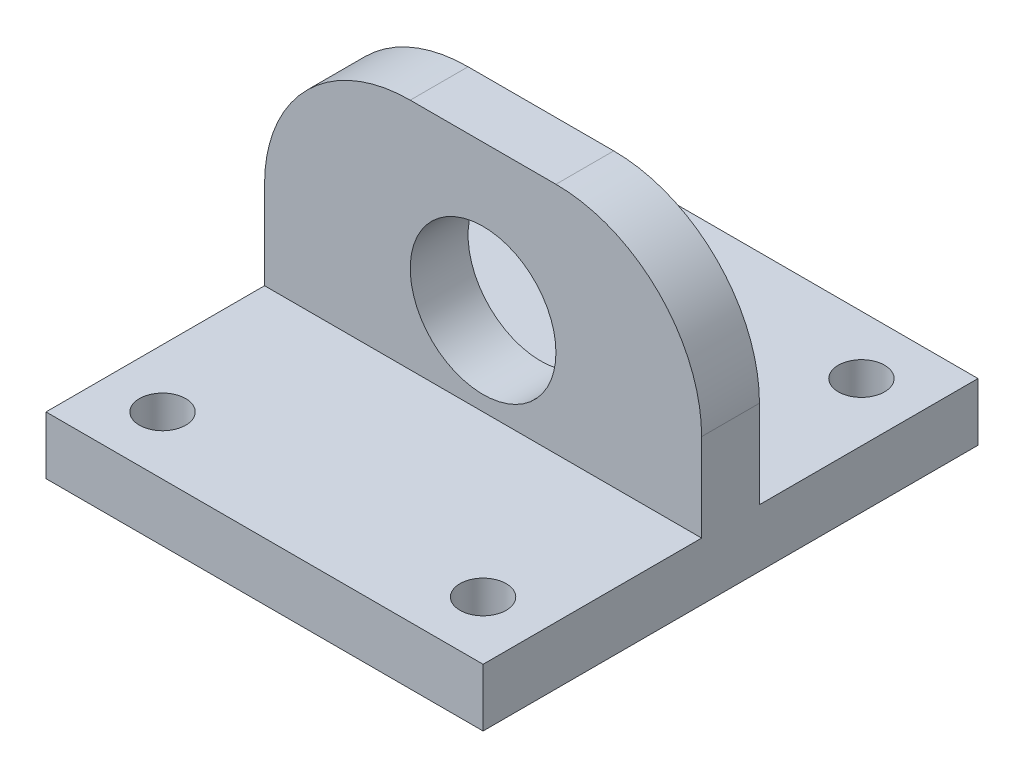
from build123d import *

# Parameters (mm, degrees)
CROQUIS1_R              = 10
SALIENTE_EXTRUIR1_DEPTH = 3.96875
CROQUIS3_W              = 30
CROQUIS3_H              = 7.9375
SALIENTE_EXTRUIR2_DEPTH = 30
CROQUIS4_R              = 3.175
CORTAR_EXTRUIR1_DEPTH   = 60


with BuildPart() as part:
    # Croquis1 → Saliente-Extruir1 (new, symmetric)
    with BuildSketch(Plane.XY):
        with BuildLine():
            Line((-30, -20), (30, -20))
            Line((30, -20), (30, 0))
            ThreePointArc((30, 0), (24.142135624, 14.142135624), (10, 20))
            Line((10, 20), (-10, 20))
            ThreePointArc((-10, 20), (-24.142135624, 14.142135624), (-30, 0))
            Line((-30, 0), (-30, -20))
        make_face()
        Circle(CROQUIS1_R, mode=Mode.SUBTRACT)
    extrude(amount=SALIENTE_EXTRUIR1_DEPTH, both=True)

    # Croquis3 → Saliente-Extruir2 (add, symmetric)
    with BuildSketch(Plane(origin=(0, 0, 0), x_dir=(0, 0, -1), z_dir=(1, 0, 0))):
        with Locations((-18.96875, -16.03125)):
            Rectangle(CROQUIS3_W, CROQUIS3_H)
        with Locations((18.96875, -16.03125)):
            Rectangle(CROQUIS3_W, CROQUIS3_H)
    extrude(amount=SALIENTE_EXTRUIR2_DEPTH, both=True)

    # Croquis4 → Cortar-Extruir1 (cut)
    with BuildSketch(Plane.XZ.offset(20)):
        with Locations((-22, 25.96875)):
            Circle(CROQUIS4_R)
        with Locations((22, 25.96875)):
            Circle(CROQUIS4_R)
        with Locations((22, -25.96875)):
            Circle(CROQUIS4_R)
        with Locations((-22, -25.96875)):
            Circle(CROQUIS4_R)
    extrude(amount=-CORTAR_EXTRUIR1_DEPTH, mode=Mode.SUBTRACT)


solid = part.part
